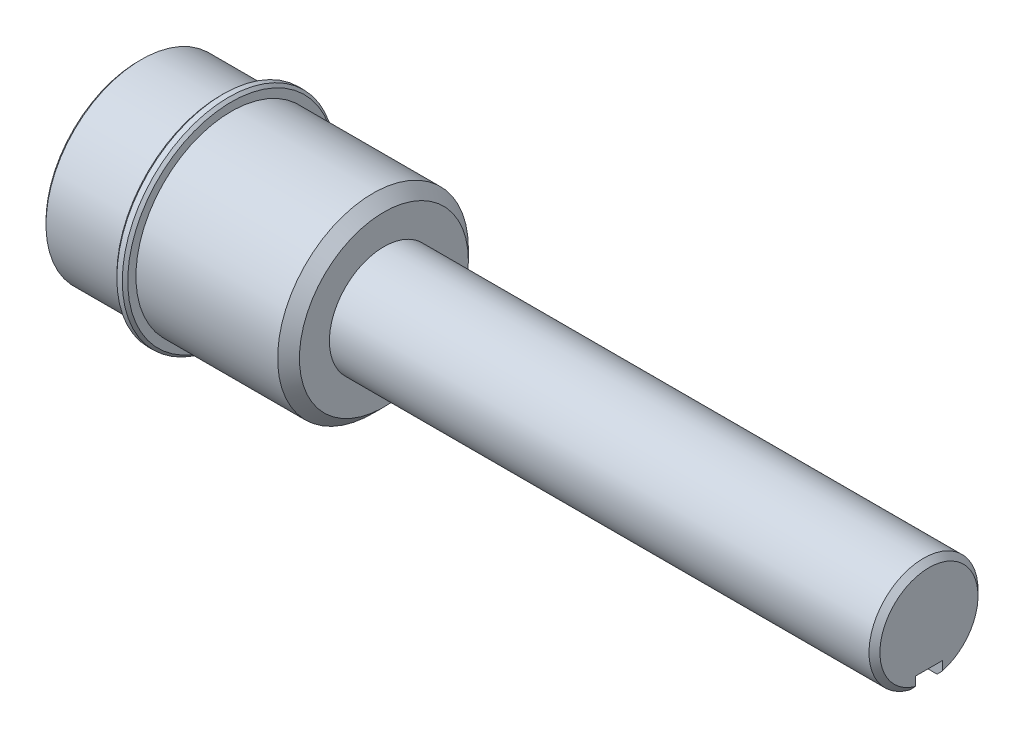
from build123d import *
from build123d.topology import SkipClean

# Parameters (mm, degrees)
CHAMFER_1_SIZE         = 2
CHAMFER_3_SIZE         = 0.5
HOLE_WIZARD_M6_1_D     = 5
HOLE_WIZARD_M6_1_DEPTH = 18
HOLE_WIZARD_M6_1_TIP   = 1.502151548
CHAMFER_2_SIZE         = 1
CUT_EXTRUDE_2_DEPTH    = 10
CUT_EXTRUDE_START      = -7
CUT_EXTRUDE_3_DEPTH    = 10
CUT_EXTRUDE_START_2    = -6.5
CUT_EXTRUDE_4_DEPTH    = 10


with BuildPart() as part:
    # 草图1 → 旋转1 (revolve)
    with BuildSketch(Plane.XY):
        Polygon((0, 0), (0, 17.5), (15, 17.5), (15, 19.5), (17, 19.5), (17, 17.5), (45, 17.5), (45, 10), (145, 10), (145, 0), align=None)
    revolve(axis=Axis((0, 0, 0), (-1, 0, 0)))

    # 倒角1
    chamfer_1_edges = [part.edges().sort_by_distance(p)[0] for p in [
        (45, -17.5, 0),
    ]]
    chamfer(chamfer_1_edges, length=CHAMFER_1_SIZE)

    # 倒角3
    chamfer_3_edges = [part.edges().sort_by_distance(p)[0] for p in [
        (17, -19.5, 0),
        (15, -19.5, 0),
        (0, -17.5, 0),
    ]]
    chamfer(chamfer_3_edges, length=CHAMFER_3_SIZE)

    # M6 螺纹孔的螺纹孔钻头1
    with Locations(Plane.ZY):
        with Locations((0, 0)):
            Hole(HOLE_WIZARD_M6_1_D / 2, depth=HOLE_WIZARD_M6_1_DEPTH)
            with Locations((0, 0, -(HOLE_WIZARD_M6_1_DEPTH + HOLE_WIZARD_M6_1_TIP / 2))):  # 118° drill point
                Cone(0, HOLE_WIZARD_M6_1_D / 2, HOLE_WIZARD_M6_1_TIP, mode=Mode.SUBTRACT)

    # 倒角2
    chamfer_2_edges = [part.edges().sort_by_distance(p)[0] for p in [
        (145, -10, 0),
        (0, 0, 2.5),
    ]]
    chamfer(chamfer_2_edges, length=CHAMFER_2_SIZE)

    # 草图5 → 切除-拉伸2 (cut)
    with SkipClean():  # the faces are left unmerged after this step: merging them gives an invalid solid
        with BuildSketch(Plane(origin=(0, -13.5, 0), x_dir=(1, 0, 0), z_dir=(0, 1, 0))):
            with BuildLine():
                Line((0, 4), (11, 4))
                ThreePointArc((11, 4), (15, 0), (11, -4))
                Line((11, -4), (0, -4))
                Line((0, -4), (0, 4))
            make_face()
        extrude(amount=-CUT_EXTRUDE_2_DEPTH, mode=Mode.SUBTRACT)

    # 草图6 → 切除-拉伸3 (cut)
    with SkipClean():  # the faces are left unmerged after this step: merging them gives an invalid solid
        with BuildSketch(Plane(origin=(0, 0, 0), x_dir=(1, 0, 0), z_dir=(0, 1, 0)).offset(CUT_EXTRUDE_START)):
            with BuildLine():
                Line((145, -2.5), (131, -2.5))
                ThreePointArc((131, -2.5), (128.5, 0), (131, 2.5))
                Line((131, 2.5), (145, 2.5))
                Line((145, 2.5), (145, -2.5))
            make_face()
        extrude(amount=-CUT_EXTRUDE_3_DEPTH, mode=Mode.SUBTRACT)

    # 草图7 → 切除-拉伸4 (cut)
    with SkipClean():  # the faces are left unmerged after this step: merging them gives an invalid solid
        with BuildSketch(Plane(origin=(0, 0, 0), x_dir=(1, 0, 0), z_dir=(0, 1, 0)).offset(CUT_EXTRUDE_START_2)):
            with BuildLine():
                Line((48, 3), (62, 3))
                ThreePointArc((62, 3), (65, 0), (62, -3))
                Line((62, -3), (48, -3))
                ThreePointArc((48, -3), (45, 0), (48, 3))
            make_face()
        extrude(amount=-CUT_EXTRUDE_4_DEPTH, mode=Mode.SUBTRACT)


solid = part.part
